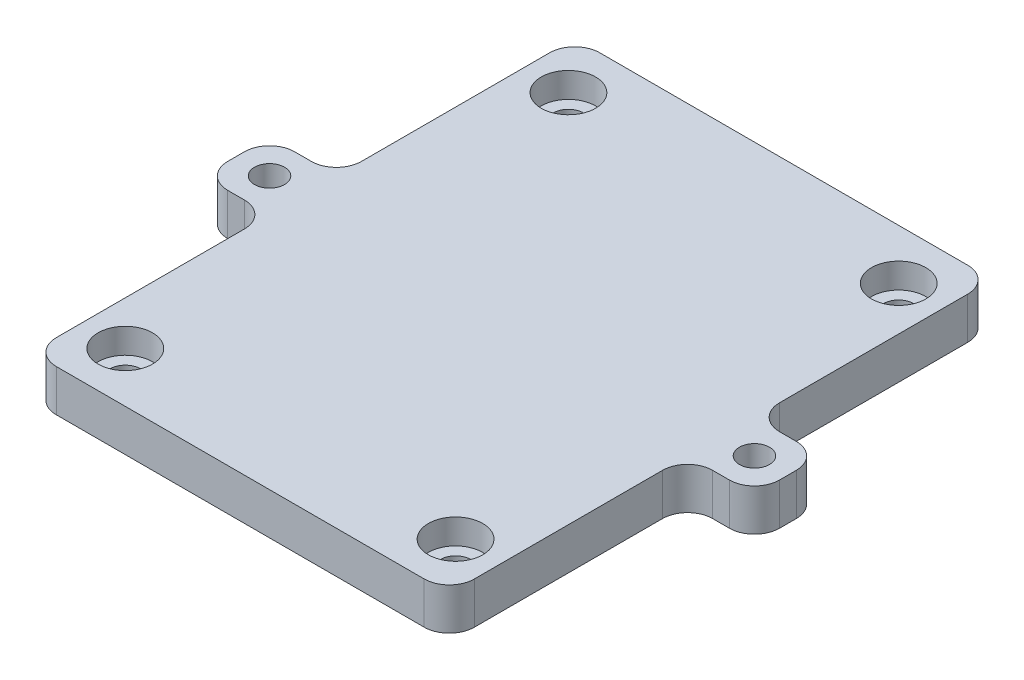
from build123d import *

# Parameters (mm, degrees)
SKETCH1_W                      = 50
SKETCH1_H                      = 65
BOSS_EXTRUDE1_DEPTH            = 5
CBORE_START                    = 2
CBORE_FOR_M3_SHCS1_OUTLINE_R   = 3.25
CBORE_FOR_M3_SHCS1_DEPTH       = 3
CBORE_FOR_M3_SHCS1_2_OUTLINE_R = 1.8
CBORE_FOR_M3_SHCS1_2_DEPTH     = 2
SKETCH5_W                      = 66
SKETCH5_H                      = 8
BOSS_EXTRUDE2_DEPTH            = 5
FILLET1_R                      = 3
M3_CLEARANCE_HOLE1_D           = 3.6


# Read off the part's stored shape, not the designer's step: CBORE for M3 SHCS1
with BuildPart() as part:
    # Sketch1 → Boss-Extrude1 (new body)
    with BuildSketch(Plane(origin=(0, 0, 0), x_dir=(1, 0, 0), z_dir=(0, 1, 0))):
        Rectangle(SKETCH1_W, SKETCH1_H)
    extrude(amount=BOSS_EXTRUDE1_DEPTH)

    # CBORE for M3 SHCS1 outline → CBORE for M3 SHCS1 (cut)
    with BuildSketch(Plane(origin=(0, 0, 0), x_dir=(1, 0, 0), z_dir=(0, 1, 0)).offset(CBORE_START)):
        with Locations((19.75, -26.5)):
            Circle(CBORE_FOR_M3_SHCS1_OUTLINE_R)
        with Locations((-19.75, 26.5)):
            Circle(CBORE_FOR_M3_SHCS1_OUTLINE_R)
        with Locations((-19.75, -26.5)):
            Circle(CBORE_FOR_M3_SHCS1_OUTLINE_R)
        with Locations((19.75, 26.5)):
            Circle(CBORE_FOR_M3_SHCS1_OUTLINE_R)
    extrude(amount=CBORE_FOR_M3_SHCS1_DEPTH, mode=Mode.SUBTRACT)

    # CBORE for M3 SHCS1 2 outline → CBORE for M3 SHCS1 2 (cut)
    with BuildSketch(Plane(origin=(0, 0, 0), x_dir=(1, 0, 0), z_dir=(0, 1, 0))):
        with Locations((19.75, -26.5)):
            Circle(CBORE_FOR_M3_SHCS1_2_OUTLINE_R)
        with Locations((-19.75, 26.5)):
            Circle(CBORE_FOR_M3_SHCS1_2_OUTLINE_R)
        with Locations((-19.75, -26.5)):
            Circle(CBORE_FOR_M3_SHCS1_2_OUTLINE_R)
        with Locations((19.75, 26.5)):
            Circle(CBORE_FOR_M3_SHCS1_2_OUTLINE_R)
    extrude(amount=CBORE_FOR_M3_SHCS1_2_DEPTH, mode=Mode.SUBTRACT)

    # Sketch5 → Boss-Extrude2 (add)
    with BuildSketch(Plane(origin=(0, 5, 0), x_dir=(1, 0, 0), z_dir=(0, 1, 0))):
        Rectangle(SKETCH5_W, SKETCH5_H)
    extrude(amount=-BOSS_EXTRUDE2_DEPTH)

    # Fillet1
    fillet1_edges = [part.edges().sort_by_distance(p)[0] for p in [
        (33, 2.5, 4),
        (-33, 2.5, -4),
        (33, 2.5, -4),
        (25, 2.5, 4),
        (-25, 2.5, 4),
        (-33, 2.5, 4),
        (25, 2.5, -4),
        (-25, 2.5, -4),
        (25, 2.5, 32.5),
        (-25, 2.5, 32.5),
        (-25, 2.5, -32.5),
        (25, 2.5, -32.5),
    ]]
    fillet(fillet1_edges, radius=FILLET1_R)

    # M3 Clearance Hole1 (through all)
    with Locations(Plane(origin=(0, 5, 0), x_dir=(1, 0, 0), z_dir=(0, 1, 0))):
        with Locations((-29, 0), (29, 0)):
            Hole(M3_CLEARANCE_HOLE1_D / 2)


solid = part.part
